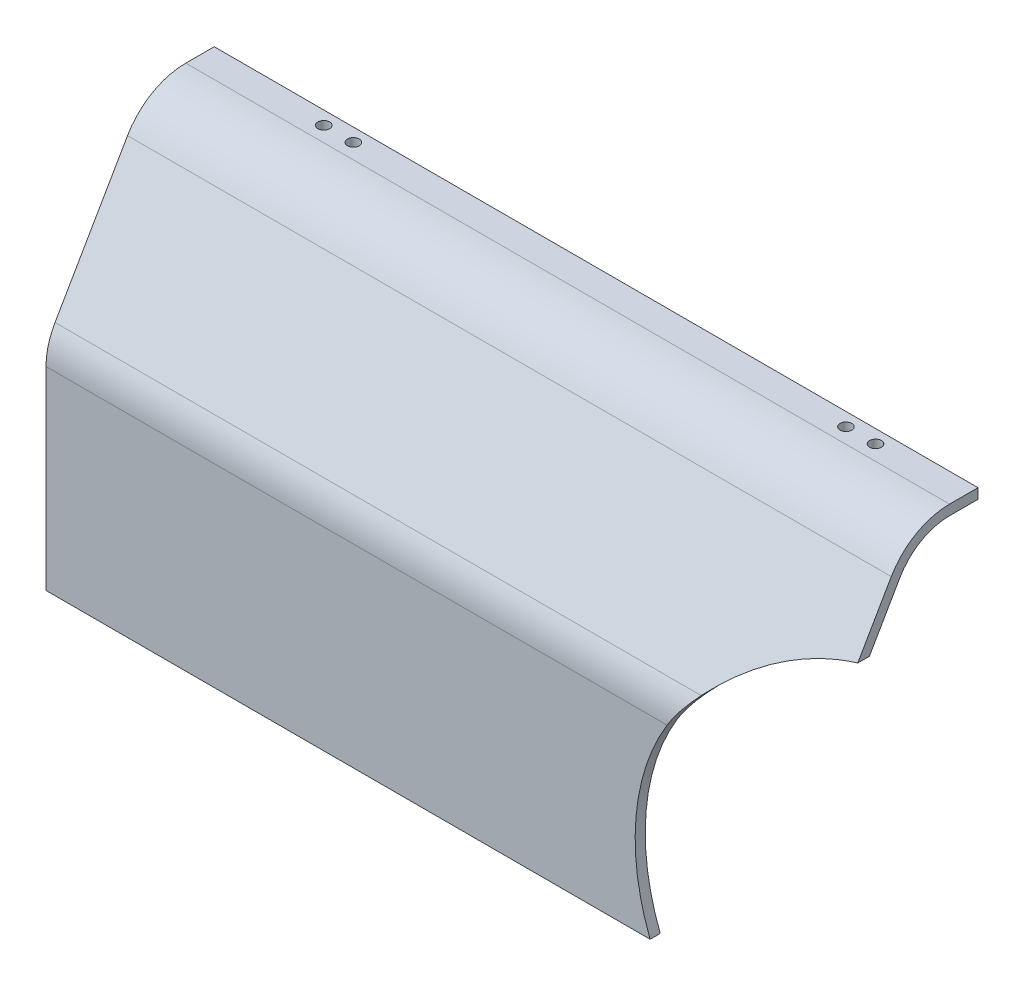
from build123d import *

# Parameters (mm, degrees)
SALIENTE_EXTRUIR1_DEPTH = 113.5
REDONDEO1_R             = 20
REDONDEO2_R             = 20
REDONDEO3_R             = 17
REDONDEO4_R             = 17
CROQUIS4_R              = 1.75
CORTAR_EXTRUIR3_DEPTH   = 4
CROQUIS5_R              = 1.75
CORTAR_EXTRUIR4_DEPTH   = 4
CROQUIS6_R              = 65.376530282
CORTAR_EXTRUIR5_DEPTH   = 20


with BuildPart() as part:
    # Croquis1 → Saliente-Extruir1 (new, symmetric)
    with BuildSketch(Plane(origin=(0, 0, 0), x_dir=(0, 0, -1), z_dir=(1, 0, 0))):
        Polygon((0, 0), (0, 62.196152423), (28.732050808, 111.961524227), (47, 111.961524227), (47, 114.961524227), (27, 114.961524227), (-3, 63), (-3, 0), align=None)
    extrude(amount=SALIENTE_EXTRUIR1_DEPTH, both=True)

    # Redondeo1
    redondeo1_edges = [part.edges().sort_by_distance(p)[0] for p in [
        (0, 63, 3),
    ]]
    fillet(redondeo1_edges, radius=REDONDEO1_R)

    # Redondeo2
    redondeo2_edges = [part.edges().sort_by_distance(p)[0] for p in [
        (0, 114.961524227, -27),
    ]]
    fillet(redondeo2_edges, radius=REDONDEO2_R)

    # Redondeo3
    redondeo3_edges = [part.edges().sort_by_distance(p)[0] for p in [
        (0, 111.961524227, -28.732050808),
    ]]
    fillet(redondeo3_edges, radius=REDONDEO3_R)

    # Redondeo4
    redondeo4_edges = [part.edges().sort_by_distance(p)[0] for p in [
        (0, 62.196152423, 0),
    ]]
    fillet(redondeo4_edges, radius=REDONDEO4_R)

    # Croquis4 → Cortar-Extruir3 (cut)
    with BuildSketch(Plane(origin=(0, 114.961524227, 0), x_dir=(1, 0, 0), z_dir=(0, 1, 0))):
        with Locations((-77, 43.047005384)):
            Circle(CROQUIS4_R)
        with Locations((-68.2, 43.047005384)):
            Circle(CROQUIS4_R)
    extrude(amount=-CORTAR_EXTRUIR3_DEPTH, mode=Mode.SUBTRACT)

    # Croquis5 → Cortar-Extruir4 (cut)
    with BuildSketch(Plane(origin=(0, 114.961524227, 0), x_dir=(1, 0, 0), z_dir=(0, 1, 0))):
        with Locations((78.2, 43.047005384)):
            Circle(CROQUIS5_R)
        with Locations((87, 43.047005384)):
            Circle(CROQUIS5_R)
    extrude(amount=-CORTAR_EXTRUIR4_DEPTH, mode=Mode.SUBTRACT)

    # Croquis6 → Cortar-Extruir5 (cut)
    with BuildSketch(Plane.XY.offset(3)):
        with Locations((126.978079309, 23.721524227)):
            Circle(CROQUIS6_R)
    extrude(amount=-CORTAR_EXTRUIR5_DEPTH, mode=Mode.SUBTRACT)


solid = part.part
